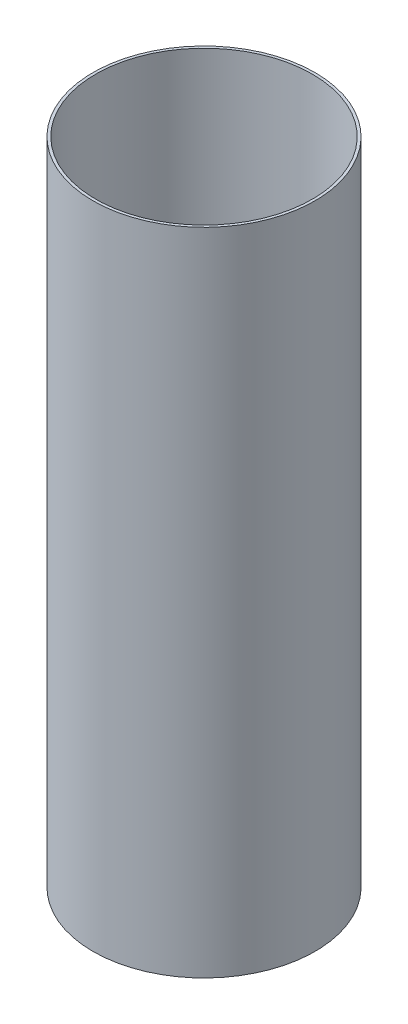
from build123d import *

# Parameters (mm, degrees)
SKETCH1_R           = 52.07
SKETCH1_R_2         = 50.8
BOSS_EXTRUDE1_DEPTH = 304.8


with BuildPart() as part:
    # Sketch1 → Boss-Extrude1 (new body)
    with BuildSketch(Plane(origin=(0, 0, 0), x_dir=(1, 0, 0), z_dir=(0, 1, 0))):
        Circle(SKETCH1_R)
        Circle(SKETCH1_R_2, mode=Mode.SUBTRACT)
    extrude(amount=BOSS_EXTRUDE1_DEPTH)


solid = part.part
